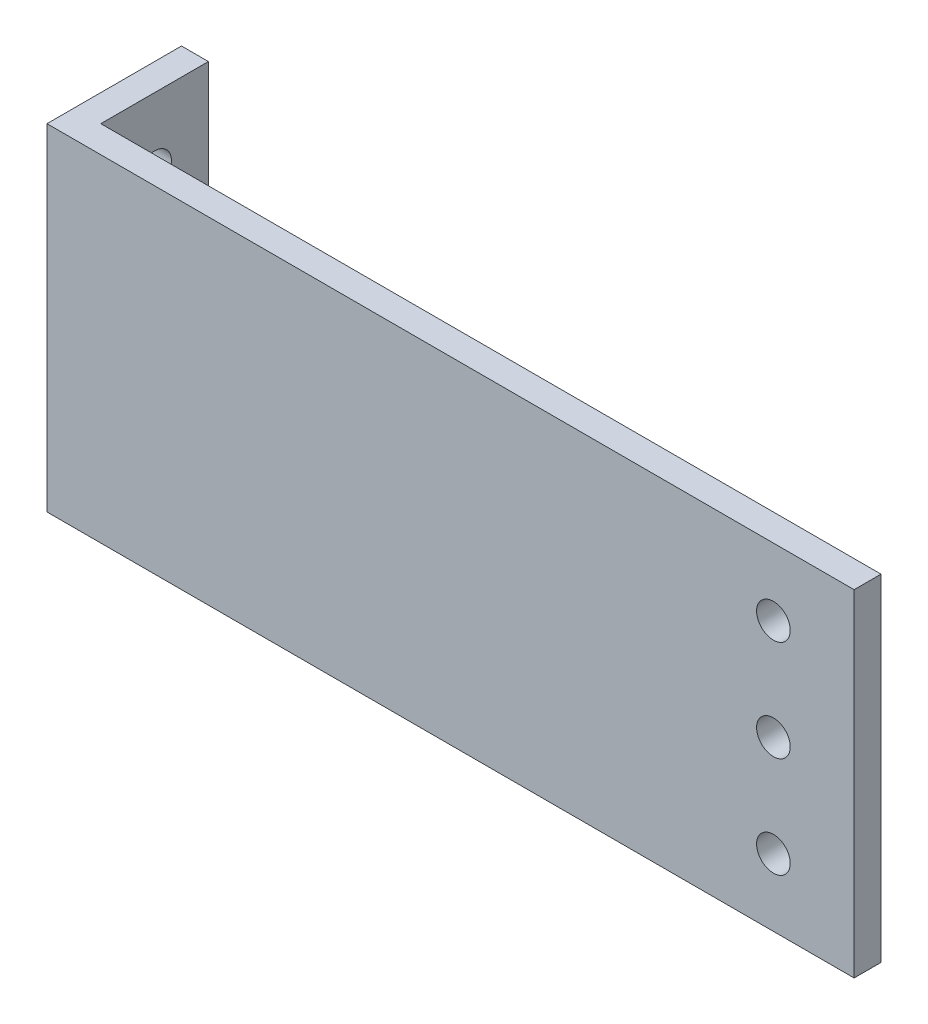
from build123d import *

# Parameters (mm, degrees)
EXTRUDE_1_DEPTH     = 50
SKETCH_2_R          = 2.5
CUT_EXTRUDE_1_DEPTH = 10
SKETCH_3_R          = 2.5
CUT_EXTRUDE_2_DEPTH = 10


with BuildPart() as part:
    # Эскиз1 → Бобышка-Вытянуть1 (new body)
    with BuildSketch(Plane(origin=(0, 0, 0), x_dir=(1, 0, 0), z_dir=(0, 1, 0))):
        Polygon((0, 0), (120, 0), (120, 4), (4, 4), (4, 20), (0, 20), (0, 4), align=None)
    extrude(amount=EXTRUDE_1_DEPTH)

    # Эскиз2 → Вырез-Вытянуть1 (cut)
    with BuildSketch(Plane.ZY):
        with Locations((-12, 40)):
            Circle(SKETCH_2_R)
        with Locations((-12, 10)):
            Circle(SKETCH_2_R)
    extrude(amount=-CUT_EXTRUDE_1_DEPTH, mode=Mode.SUBTRACT)

    # Эскиз3 → Вырез-Вытянуть2 (cut)
    with BuildSketch(Plane.XY):
        with Locations((108, 40)):
            Circle(SKETCH_3_R)
        with Locations((108, 10)):
            Circle(SKETCH_3_R)
        with Locations((108, 25)):
            Circle(SKETCH_3_R)
    extrude(amount=-CUT_EXTRUDE_2_DEPTH, mode=Mode.SUBTRACT)


solid = part.part
